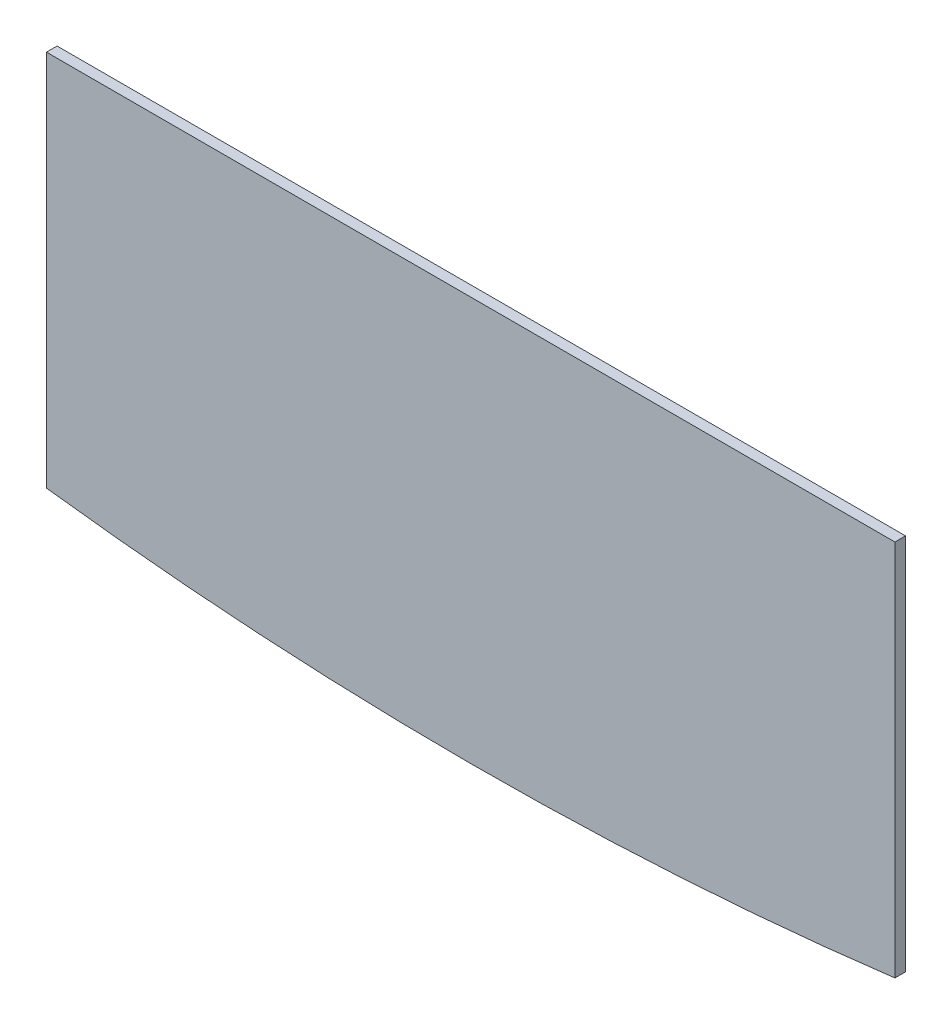
from build123d import *

# Parameters (mm, degrees)
EXTRUDE_1_DEPTH = 1


with BuildPart() as part:
    # 草图1 → 凸台-拉伸1 (new body)
    with BuildSketch(Plane.XY):
        with BuildLine():
            ThreePointArc((-90.420566467, -29.267328482), (-50.420566467, -31.763413079), (-10.420566467, -29.267328482))
            Line((-10.420566467, -29.267328482), (-10.420566467, 6.332671518))
            Line((-10.420566467, 6.332671518), (-90.420566467, 6.332671518))
            Line((-90.420566467, 6.332671518), (-90.420566467, -29.267328482))
        make_face()
    extrude(amount=EXTRUDE_1_DEPTH)


solid = part.part
